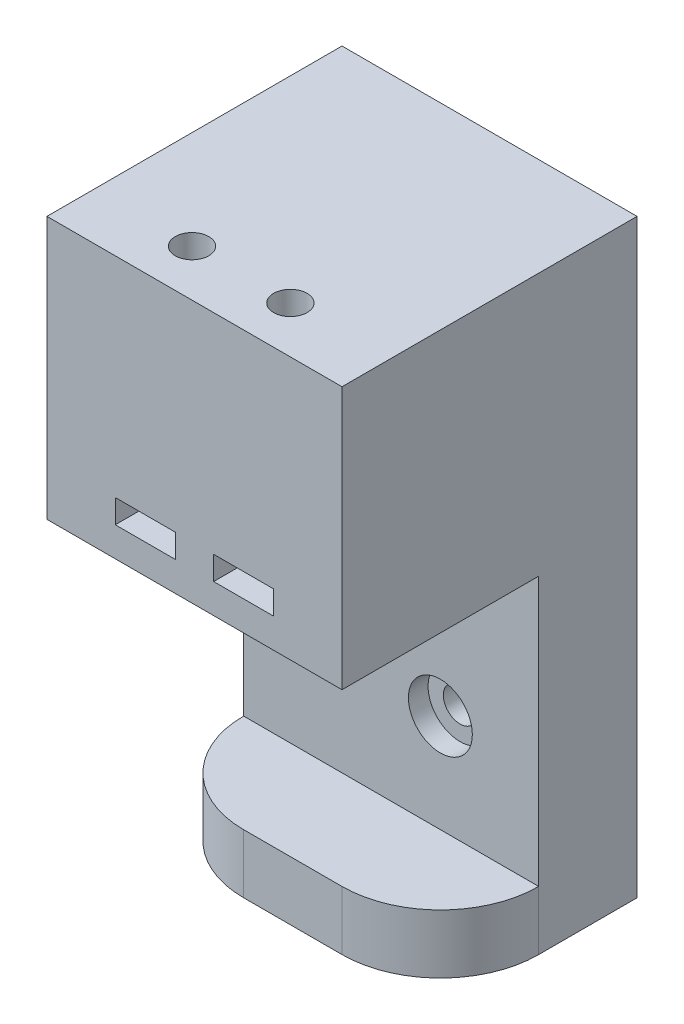
from build123d import *

# Parameters (mm, degrees)
ESQUISSE1_W                                          = 30
ESQUISSE1_H                                          = 60
BOSS_EXTRU_1_DEPTH                                   = 10
ESQUISSE2_W                                          = 30
ESQUISSE2_H                                          = 6
BOSS_EXTRU_2_DEPTH                                   = 10
ESQUISSE4_W                                          = 30
ESQUISSE4_H                                          = 26.68
BOSS_EXTRU_3_DEPTH                                   = 20
D_GAGEMENT_M31_D                                     = 3.4
D_GAGEMENT_M31_DEPTH                                 = 26.68
D_GAGEMENT_M31_TIP                                   = 1.021463052
CHAMBRAGE_POUR_T_TE_CYLINDRIQUE_FENDUE_M_D           = 3.4
CHAMBRAGE_POUR_T_TE_CYLINDRIQUE_FENDUE_M_DEPTH       = 10
CHAMBRAGE_POUR_T_TE_CYLINDRIQUE_FENDUE_M_CBORE_D     = 6.5
CHAMBRAGE_POUR_T_TE_CYLINDRIQUE_FENDUE_M_CBORE_DEPTH = 2
CHAMBRAGE_POUR_T_TE_CYLINDRIQUE_FENDUE_M_TIP         = 1.021463052
CONG_1_R                                             = 10
ESQUISSE13_W                                         = 6.1
ESQUISSE13_H                                         = 2.4
ENL_V_MAT_EXTRU_2_DEPTH                              = 8.45


with BuildPart() as part:
    # Esquisse1 → Boss.-Extru.1 (new body)
    with BuildSketch(Plane.XY):
        with Locations((15, 30)):
            Rectangle(ESQUISSE1_W, ESQUISSE1_H)
    extrude(amount=BOSS_EXTRU_1_DEPTH)

    # Esquisse2 → Boss.-Extru.2 (add)
    with BuildSketch(Plane.XY.offset(10)):
        with Locations((15, 3)):
            Rectangle(ESQUISSE2_W, ESQUISSE2_H)
    extrude(amount=BOSS_EXTRU_2_DEPTH)

    # Esquisse4 → Boss.-Extru.3 (add)
    with BuildSketch(Plane.XY.offset(10)):
        with Locations((15, 46.66)):
            Rectangle(ESQUISSE4_W, ESQUISSE4_H)
    extrude(amount=BOSS_EXTRU_3_DEPTH)

    # Dégagement M31
    with Locations(Plane(origin=(0, 33.32, 0), x_dir=(-1, 0, 0), z_dir=(0, -1, 0))):
        with Locations((-10, -25.25), (-20, -25.25)):
            Hole(D_GAGEMENT_M31_D / 2, depth=D_GAGEMENT_M31_DEPTH)
            with Locations((0, 0, -(D_GAGEMENT_M31_DEPTH + D_GAGEMENT_M31_TIP / 2))):  # 118° drill point
                Cone(0, D_GAGEMENT_M31_D / 2, D_GAGEMENT_M31_TIP, mode=Mode.SUBTRACT)

    # Chambrage pour tête cylindrique fendue M31
    with Locations(Plane.XY.offset(10)):
        with Locations((10, 23.32), (20, 16)):
            CounterBoreHole(CHAMBRAGE_POUR_T_TE_CYLINDRIQUE_FENDUE_M_D / 2, CHAMBRAGE_POUR_T_TE_CYLINDRIQUE_FENDUE_M_CBORE_D / 2, CHAMBRAGE_POUR_T_TE_CYLINDRIQUE_FENDUE_M_CBORE_DEPTH, depth=CHAMBRAGE_POUR_T_TE_CYLINDRIQUE_FENDUE_M_DEPTH)
            with Locations((0, 0, -(CHAMBRAGE_POUR_T_TE_CYLINDRIQUE_FENDUE_M_DEPTH + CHAMBRAGE_POUR_T_TE_CYLINDRIQUE_FENDUE_M_TIP / 2))):  # 118° drill point
                Cone(0, CHAMBRAGE_POUR_T_TE_CYLINDRIQUE_FENDUE_M_D / 2, CHAMBRAGE_POUR_T_TE_CYLINDRIQUE_FENDUE_M_TIP, mode=Mode.SUBTRACT)

    # Congé1
    cong_1_edges = [part.edges().sort_by_distance(p)[0] for p in [
        (30, 3, 20),
        (0, 3, 20),
    ]]
    fillet(cong_1_edges, radius=CONG_1_R)

    # Esquisse13 → Enlèv. mat.-Extru.2 (cut)
    with BuildSketch(Plane.XY.offset(30)):
        with Locations((10, 37.52)):
            Rectangle(ESQUISSE13_W, ESQUISSE13_H)
        with Locations((20, 37.52)):
            Rectangle(ESQUISSE13_W, ESQUISSE13_H)
    extrude(amount=-ENL_V_MAT_EXTRU_2_DEPTH, mode=Mode.SUBTRACT)


solid = part.part
